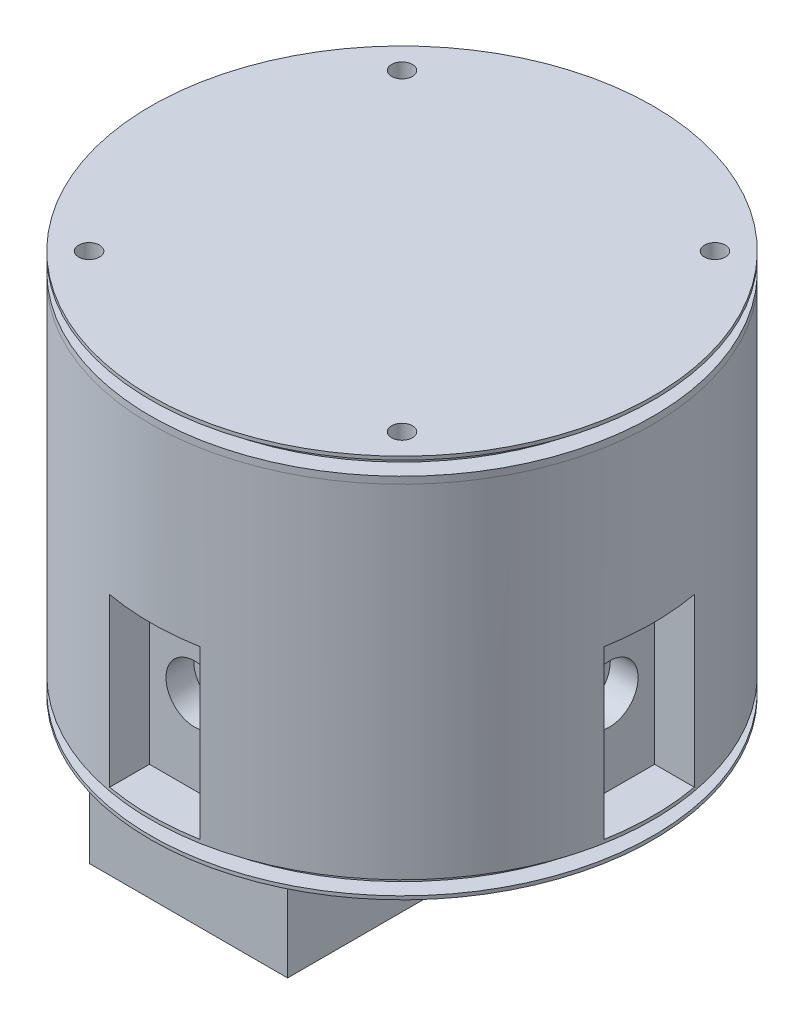
from build123d import *
from OCP.BRepFilletAPI import BRepFilletAPI_MakeFillet

# Parameters (mm, degrees)
EXTRUDE_START            = -2
SKETCH_1_R               = 72.25
EXTRUDE_8_DEPTH          = 99.5
SKETCH_5_W               = 10.5
SKETCH_5_H               = 22
SKETCH_5_W_2             = 22
SKETCH_5_H_2             = 10.5
CUT_EXTRUDE_1_DEPTH      = 48
SKETCH_40_R              = 8.25
CUT_EXTRUDE_2_DEPTH      = 8
PATTERN_CIRCULAR_1_COUNT = 4
SHELL_START              = -49.642711667
SHELL_6_OUTLINE_W        = 30
SHELL_6_OUTLINE_H        = 50
SHELL_6_DEPTH            = 99.285423334
SHELL_START_2            = -57.642711667
SHELL_6_2_OUTLINE_W      = 30
SHELL_6_2_OUTLINE_H      = 50
SHELL_6_2_OUTLINE_R      = 10.25
SHELL_6_2_DEPTH          = 115.285423334
SHELL_6_3_OUTLINE_W      = 50
SHELL_6_3_OUTLINE_H      = 30
SHELL_6_3_DEPTH          = 99.285423334
SHELL_6_4_OUTLINE_W      = 50
SHELL_6_4_OUTLINE_H      = 30
SHELL_6_4_OUTLINE_R      = 10.25
SHELL_6_4_DEPTH          = 115.285423334
SHELL_6_5_DEPTH          = 97.5
SHELL_START_3            = 50
SHELL_6_6_DEPTH          = 47.5
CUT_EXTRUDE_5_DEPTH      = 48
SKETCH_37_W              = 68
SKETCH_37_H              = 1.5
EXTRUDE_9_DEPTH          = 34
EXTRUDE_9_2_DEPTH        = 34
EXTRUDE_9_3_DEPTH        = 34
EXTRUDE_9_4_DEPTH        = 34
EXTRUDE_9_5_DEPTH        = 34
EXTRUDE_10_DEPTH         = 65
EXTRUDE_11_DEPTH         = 55
EXTRUDE_START_2          = -6
SKETCH_1_26_R            = 72.25
EXTRUDE_13_DEPTH         = 6
SKETCH_47_W              = 57
SKETCH_47_H              = 106
EXTRUDE_12_DEPTH         = 34
SKETCH_50_R              = 6
CUT_EXTRUDE_6_DEPTH      = 6
EXTRUDE_START_3          = 91.5
SKETCH_1_36_R            = 72.25
SKETCH_1_36_R_2          = 71
SKETCH_1_36_R_3          = 68
SKETCH_1_36_R_4          = 67
EXTRUDE_19_DEPTH         = 6
CUT_EXTRUDE_START        = 97.5
SKETCH_1_37_R            = 71
SKETCH_1_37_R_2          = 68
CUT_EXTRUDE_11_DEPTH     = 2
EXTRUDE_START_4          = -97.5
EXTRUDE_20_DEPTH         = 6
SKETCH_62_W              = 5
SKETCH_62_H              = 4
SKETCH_63_R              = 1.5
CUT_EXTRUDE_12_DEPTH     = 6
EXTRUDE_START_5          = 97.5
SKETCH_1_39_R            = 72.25
EXTRUDE_22_DEPTH         = 7
SKETCH_64_R              = 3
CUT_EXTRUDE_13_DEPTH     = 6
CUT_EXTRUDE_START_2      = 6
SKETCH_63_2_R            = 1.5
CUT_EXTRUDE_14_DEPTH     = 6
SKETCH_65_R              = 1.5
CUT_EXTRUDE_15_DEPTH     = 6
SKETCH_66_W              = 5
SKETCH_66_H              = 4
SKETCH_1_41_R            = 68
SKETCH_1_41_R_2          = 67
EXTRUDE_24_DEPTH         = 6
SKETCH_61_R              = 1.5
CUT_EXTRUDE_16_DEPTH     = 6
PATTERN_CIRCULAR_2_COUNT = 4
EXTRUDE_27_OUTLINE_W     = 85
EXTRUDE_27_OUTLINE_H     = 80
EXTRUDE_27_OUTLINE_R     = 2
EXTRUDE_27_DEPTH         = 25
SKETCH_71_W              = 85
SKETCH_71_H              = 80
EXTRUDE_28_DEPTH         = 1.8
EXTRUDE_START_6          = 25
EXTRUDE_29_DEPTH         = 1
EXTRUDE_30_OUTLINE_W     = 85
EXTRUDE_30_OUTLINE_H     = 80
EXTRUDE_30_OUTLINE_R     = 2
EXTRUDE_30_DEPTH         = 1.5
FILLET_2_R1              = 3
FILLET_2_R2              = 2
FILLET_3_R               = 3
SKETCH_72_R              = 4
CUT_EXTRUDE_17_DEPTH     = 7


with BuildPart() as part:
    # 草圖1 → 填料-伸長8 (new body)
    with BuildSketch(Plane(origin=(0, 0, 0), x_dir=(1, 0, 0), z_dir=(0, 1, 0)).offset(EXTRUDE_START)):
        with Locations(Location((0, 0, 0), (0, 0, 270))):
            Circle(SKETCH_1_R)
    extrude(amount=EXTRUDE_8_DEPTH)

    # 草圖5 → 除料-伸長1 (cut)
    with BuildSketch(Plane(origin=(0, 0, 0), x_dir=(1, 0, 0), z_dir=(0, 1, 0))):
        with Locations((64.892711667, 0)):
            Rectangle(SKETCH_5_W, SKETCH_5_H)
        with BuildLine():
            ThreePointArc((72.25, 0), (71.954602966, 6.526684613), (71.070827348, 13))
            Line((71.070827348, 13), (59.642711667, 13))
            Line((59.642711667, 13), (59.642711667, 11))
            Line((59.642711667, 11), (70.142711667, 11))
            Line((70.142711667, 11), (70.142711667, -11))
            Line((70.142711667, -11), (59.642711667, -11))
            Line((59.642711667, -11), (59.642711667, -13))
            Line((59.642711667, -13), (71.070827348, -13))
            ThreePointArc((71.070827348, -13), (71.954602966, -6.526684613), (72.25, 0))
        make_face()
        with Locations((0, 64.892711667)):
            Rectangle(SKETCH_5_W_2, SKETCH_5_H_2)
        with BuildLine():
            ThreePointArc((13, 71.070827348), (0, 72.25), (-13, 71.070827348))
            Line((-13, 71.070827348), (-13, 59.642711667))
            Line((-13, 59.642711667), (-11, 59.642711667))
            Line((-11, 59.642711667), (-11, 70.142711667))
            Line((-11, 70.142711667), (11, 70.142711667))
            Line((11, 70.142711667), (11, 59.642711667))
            Line((11, 59.642711667), (13, 59.642711667))
            Line((13, 59.642711667), (13, 71.070827348))
        make_face()
        with Locations((-64.892711667, 0)):
            Rectangle(SKETCH_5_W, SKETCH_5_H)
        with BuildLine():
            Line((-70.142711667, -11), (-70.142711667, 11))
            Line((-70.142711667, 11), (-59.642711667, 11))
            Line((-59.642711667, 11), (-59.642711667, 13))
            Line((-59.642711667, 13), (-71.070827348, 13))
            ThreePointArc((-71.070827348, 13), (-72.25, 0), (-71.070827348, -13))
            Line((-71.070827348, -13), (-59.642711667, -13))
            Line((-59.642711667, -13), (-59.642711667, -11))
            Line((-59.642711667, -11), (-70.142711667, -11))
        make_face()
        with Locations((0, -64.892711667)):
            Rectangle(SKETCH_5_W_2, SKETCH_5_H_2)
        with BuildLine():
            Line((-13, -59.642711667), (-13, -71.070827348))
            ThreePointArc((-13, -71.070827348), (0, -72.25), (13, -71.070827348))
            Line((13, -71.070827348), (13, -59.642711667))
            Line((13, -59.642711667), (11, -59.642711667))
            Line((11, -59.642711667), (11, -70.142711667))
            Line((11, -70.142711667), (-11, -70.142711667))
            Line((-11, -70.142711667), (-11, -59.642711667))
            Line((-11, -59.642711667), (-13, -59.642711667))
        make_face()
    extrude(amount=CUT_EXTRUDE_1_DEPTH, mode=Mode.SUBTRACT)

    # 草圖40 → 除料-伸長2 (cut)
    with BuildSketch(Plane(origin=(0, 0, -59.642711667), x_dir=(-1, 0, 0), z_dir=(0, 0, -1))):
        with Locations((0, 24)):
            Circle(SKETCH_40_R)
    cut_extrude_2 = extrude(amount=-CUT_EXTRUDE_2_DEPTH, mode=Mode.SUBTRACT)

    # 環狀複製排列1: 除料-伸長2 ×4 about axis
    pattern_circular_1_axis = Axis((0, 0, 0), (0, 1, 0))
    for i in range(1, PATTERN_CIRCULAR_1_COUNT):
        add(cut_extrude_2.rotate(pattern_circular_1_axis, i * 360 / PATTERN_CIRCULAR_1_COUNT), mode=Mode.SUBTRACT)

    # 薄殼6: read off the stored shape, not the designer's step
    # 薄殼6 outline → 薄殼6 (cut)
    with BuildSketch(Plane.XY.offset(SHELL_START)):
        with Locations((0, 25)):
            Rectangle(SHELL_6_OUTLINE_W, SHELL_6_OUTLINE_H)
    extrude(amount=SHELL_6_DEPTH, mode=Mode.SUBTRACT)

    # Shell 6 2 outline → Shell 6 2 (cut)
    with BuildSketch(Plane.XY.offset(SHELL_START_2)):
        with Locations((0, 25)):
            Rectangle(SHELL_6_2_OUTLINE_W, SHELL_6_2_OUTLINE_H)
        with Locations((0, 24)):
            Circle(SHELL_6_2_OUTLINE_R, mode=Mode.SUBTRACT)
    extrude(amount=SHELL_6_2_DEPTH, mode=Mode.SUBTRACT)

    # Shell 6 3 outline → Shell 6 3 (cut)
    with BuildSketch(Plane.YZ.offset(SHELL_START)):
        with Locations((25, 0)):
            Rectangle(SHELL_6_3_OUTLINE_W, SHELL_6_3_OUTLINE_H)
    extrude(amount=SHELL_6_3_DEPTH, mode=Mode.SUBTRACT)

    # Shell 6 4 outline → Shell 6 4 (cut)
    with BuildSketch(Plane.YZ.offset(SHELL_START_2)):
        with Locations((25, 0)):
            Rectangle(SHELL_6_4_OUTLINE_W, SHELL_6_4_OUTLINE_H)
        with Locations((24, 0)):
            Circle(SHELL_6_4_OUTLINE_R, mode=Mode.SUBTRACT)
    extrude(amount=SHELL_6_4_DEPTH, mode=Mode.SUBTRACT)

    # Shell 6 5 outline → Shell 6 5 (cut)
    with BuildSketch(Plane(origin=(0, 0, 0), x_dir=(1, 0, 0), z_dir=(0, 1, 0))):
        with BuildLine():
            Line((15, 15), (68.62989509, 15))
            ThreePointArc((68.62989509, 15), (49.674251378, 49.674251378), (15, 68.62989509))
            Line((15, 68.62989509), (15, 15))
        make_face()
        with BuildLine():
            ThreePointArc((15, -68.62989509), (49.674251378, -49.674251378), (68.62989509, -15))
            Line((68.62989509, -15), (15, -15))
            Line((15, -15), (15, -68.62989509))
        make_face()
        with BuildLine():
            Line((-15, 15), (-15, 68.62989509))
            ThreePointArc((-15, 68.62989509), (-49.674251378, 49.674251378), (-68.62989509, 15))
            Line((-68.62989509, 15), (-15, 15))
        make_face()
        with BuildLine():
            ThreePointArc((-68.62989509, -15), (-49.674251378, -49.674251378), (-15, -68.62989509))
            Line((-15, -68.62989509), (-15, -15))
            Line((-15, -15), (-68.62989509, -15))
        make_face()
    extrude(amount=SHELL_6_5_DEPTH, mode=Mode.SUBTRACT)

    # Shell 6 6 outline → Shell 6 6 (cut)
    with BuildSketch(Plane(origin=(0, 0, 0), x_dir=(1, 0, 0), z_dir=(0, 1, 0)).offset(SHELL_START_3)):
        with BuildLine():
            ThreePointArc((68.62989509, -15), (70.25, 0), (68.62989509, 15))
            Line((68.62989509, 15), (15, 15))
            Line((15, 15), (15, 68.62989509))
            ThreePointArc((15, 68.62989509), (0, 70.25), (-15, 68.62989509))
            Line((-15, 68.62989509), (-15, 15))
            Line((-15, 15), (-68.62989509, 15))
            ThreePointArc((-68.62989509, 15), (-70.25, 0), (-68.62989509, -15))
            Line((-68.62989509, -15), (-15, -15))
            Line((-15, -15), (-15, -68.62989509))
            ThreePointArc((-15, -68.62989509), (0, -70.25), (15, -68.62989509))
            Line((15, -68.62989509), (15, -15))
            Line((15, -15), (68.62989509, -15))
        make_face()
    extrude(amount=SHELL_6_6_DEPTH, mode=Mode.SUBTRACT)

    # 草圖43 → 除料-伸長5 (cut)
    with BuildSketch(Plane(origin=(0, 0, 0), x_dir=(1, 0, 0), z_dir=(0, 1, 0))):
        Polygon((15.617248129, 51.642711667), (-24.146545114, 51.642711667), (-51.642711667, 15.617248129), (-51.642711667, -24.146545114), (-15.617248129, -51.642711667), (24.146545114, -51.642711667), (51.642711667, -15.617248129), (51.642711667, 24.146545114), align=None)
    extrude(amount=CUT_EXTRUDE_5_DEPTH, mode=Mode.SUBTRACT)

    # 草圖1<26> → 填料-伸長13 (add)
    with BuildSketch(Plane(origin=(0, 0, 0), x_dir=(1, 0, 0), z_dir=(0, 1, 0)).offset(EXTRUDE_START_2)):
        with Locations(Location((0, 0, 0), (0, 0, 270))):
            Circle(SKETCH_1_26_R)
    extrude(amount=EXTRUDE_13_DEPTH)

    # 草圖50 → 除料-伸長6 (cut)
    with BuildSketch(Plane(origin=(0, 0, 0), x_dir=(1, 0, 0), z_dir=(0, 1, 0))):
        with Locations(Location((18.322761596, 49.972985564, 0), (0, 0, 270))):
            Circle(SKETCH_50_R)
        with Locations(Location((-49.972985564, -18.322761596, 0), (0, 0, 270))):
            Circle(SKETCH_50_R)
    extrude(amount=-CUT_EXTRUDE_6_DEPTH, mode=Mode.SUBTRACT)

    # 草圖1<36> → 填料-伸長19 (add)
    # profile 1 of 3: a face of its own
    with BuildSketch(Plane(origin=(0, 0, 0), x_dir=(1, 0, 0), z_dir=(0, 1, 0)).offset(EXTRUDE_START_3)):
        with Locations(Location((0, 0, 0), (0, 0, 270))):
            Circle(SKETCH_1_36_R)
        Circle(SKETCH_1_36_R_2, mode=Mode.SUBTRACT)
    # profile 2 of 3: a face of its own
    with BuildSketch(Plane(origin=(0, 0, 0), x_dir=(1, 0, 0), z_dir=(0, 1, 0)).offset(EXTRUDE_START_3)):
        Circle(SKETCH_1_36_R_2)
        Circle(SKETCH_1_36_R_3, mode=Mode.SUBTRACT)
    # profile 3 of 3: a face of its own
    with BuildSketch(Plane(origin=(0, 0, 0), x_dir=(1, 0, 0), z_dir=(0, 1, 0)).offset(EXTRUDE_START_3)):
        Circle(SKETCH_1_36_R_3)
        with Locations(Location((0, 0, 0), (0, 0, 270))):
            Circle(SKETCH_1_36_R_4, mode=Mode.SUBTRACT)
    extrude(amount=EXTRUDE_19_DEPTH)

    # 草圖1<37> → 除料-伸長11 (cut)
    with BuildSketch(Plane(origin=(0, 0, 0), x_dir=(1, 0, 0), z_dir=(0, 1, 0)).offset(CUT_EXTRUDE_START)):
        with Locations(Location((0, 0, 0), (0, 0, 270))):
            Circle(SKETCH_1_37_R)
        with Locations(Location((0, 0, 0), (0, 0, 270))):
            Circle(SKETCH_1_37_R_2, mode=Mode.SUBTRACT)
    extrude(amount=-CUT_EXTRUDE_11_DEPTH, mode=Mode.SUBTRACT)

    # 草圖57 → 填料-伸長20 (add)
    with BuildSketch(Plane.XZ.offset(6).offset(EXTRUDE_START_4)):
        with BuildLine():
            Line((-49.280774487, 45.39168719), (-45, 41.110912703))
            Line((-45, 41.110912703), (-41.110912703, 45))
            Line((-41.110912703, 45), (-45.39168719, 49.280774487))
            ThreePointArc((-45.39168719, 49.280774487), (-47.376154339, 47.376154339), (-49.280774487, 45.39168719))
        make_face()
        with BuildLine():
            Line((-45, -41.110912703), (-49.280774487, -45.39168719))
            ThreePointArc((-49.280774487, -45.39168719), (-47.376154339, -47.376154339), (-45.39168719, -49.280774487))
            Line((-45.39168719, -49.280774487), (-41.110912703, -45))
            Line((-41.110912703, -45), (-45, -41.110912703))
        make_face()
        with BuildLine():
            Line((41.110912703, -45), (45.39168719, -49.280774487))
            ThreePointArc((45.39168719, -49.280774487), (47.376154339, -47.376154339), (49.280774487, -45.39168719))
            Line((49.280774487, -45.39168719), (45, -41.110912703))
            Line((45, -41.110912703), (41.110912703, -45))
        make_face()
        with BuildLine():
            ThreePointArc((49.280774487, 45.39168719), (47.376154339, 47.376154339), (45.39168719, 49.280774487))
            Line((45.39168719, 49.280774487), (41.110912703, 45))
            Line((41.110912703, 45), (45, 41.110912703))
            Line((45, 41.110912703), (49.280774487, 45.39168719))
        make_face()
    extrude(amount=-EXTRUDE_20_DEPTH)

    # 草圖62 → 除料-旋轉2 (revolve, cut)
    with BuildSketch(Plane(origin=(0, 0, 0), x_dir=(-0.7071067811865476, 0, 0.7071067811865476), z_dir=(-0.7071067811865476, 0, -0.7071067811865476)), mode=Mode.PRIVATE) as cut_revolve_2_sk:
        with Locations((-69.75, -3)):
            Rectangle(SKETCH_62_W, SKETCH_62_H)
    revolve(cut_revolve_2_sk.sketch.rotate(Axis((0, 0, 0), (0, 1, 0)), 45), axis=Axis((0, 0, 0), (0, 1, 0)), mode=Mode.SUBTRACT)

    # 草圖63 → 除料-伸長12 (cut)
    with BuildSketch(Plane(origin=(0, 97.5, 0), x_dir=(1, 0, 0), z_dir=(0, 1, 0))):
        with Locations(Location((-45, 45, 0), (0, 0, 270))):
            Circle(SKETCH_63_R)
        with Locations(Location((45, 45, 0), (0, 0, 270))):
            Circle(SKETCH_63_R)
        with Locations(Location((45, -45, 0), (0, 0, 270))):
            Circle(SKETCH_63_R)
        with Locations(Location((-45, -45, 0), (0, 0, 270))):
            Circle(SKETCH_63_R)
    extrude(amount=-CUT_EXTRUDE_12_DEPTH, mode=Mode.SUBTRACT)

    # 草圖1<41> → 填料-伸長24 (add)
    with BuildSketch(Plane(origin=(0, 0, 0), x_dir=(1, 0, 0), z_dir=(0, 1, 0)).offset(EXTRUDE_START_3)):
        with Locations(Location((0, 0, 0), (0, 0, 270))):
            Circle(SKETCH_1_41_R)
        Circle(SKETCH_1_41_R_2, mode=Mode.SUBTRACT)
    extrude(amount=EXTRUDE_24_DEPTH)

    # 草圖61 → 除料-伸長16 (cut)
    with BuildSketch(Plane(origin=(0, 0, 0), x_dir=(1, 0, 0), z_dir=(0, 1, 0))):
        with Locations(Location((-42.426406871, 0, 0), (0, 0, 90))):
            Circle(SKETCH_61_R)
    cut_extrude_16 = extrude(amount=-CUT_EXTRUDE_16_DEPTH, mode=Mode.SUBTRACT)

    # 環狀複製排列2: 除料-伸長16 ×4 about axis
    pattern_circular_2_axis = Axis((0, 0, 0), (0, 1, 0))
    for i in range(1, PATTERN_CIRCULAR_2_COUNT):
        add(cut_extrude_16.rotate(pattern_circular_2_axis, i * 360 / PATTERN_CIRCULAR_2_COUNT), mode=Mode.SUBTRACT)


with BuildPart() as body_2:
    # 草圖37 → 填料-伸長9 (new, symmetric)
    with BuildSketch(Plane(origin=(0, 0, 0), x_dir=(-0.7071067811865476, 0, 0.7071067811865476), z_dir=(-0.7071067811865476, 0, -0.7071067811865476))):
        with Locations((0, 48.75)):
            Rectangle(SKETCH_37_W, SKETCH_37_H)
    extrude(amount=EXTRUDE_9_DEPTH, both=True)


with BuildPart() as body_3:
    # 草圖37 → Extrude 9 2 (new, symmetric)
    with BuildSketch(Plane(origin=(0, 0, 0), x_dir=(-0.7071067811865476, 0, 0.7071067811865476), z_dir=(-0.7071067811865476, 0, -0.7071067811865476))):
        Polygon((-34, 33), (-34, 31.5), (-31.5, 31.5), (34, 31.5), (34, 33), align=None)
    extrude(amount=EXTRUDE_9_2_DEPTH, both=True)


with BuildPart() as body_4:
    # 草圖37 → Extrude 9 3 (new, symmetric)
    with BuildSketch(Plane(origin=(0, 0, 0), x_dir=(-0.7071067811865476, 0, 0.7071067811865476), z_dir=(-0.7071067811865476, 0, -0.7071067811865476))):
        Polygon((-34, 16.5), (-34, 15), (34, 15), (34, 16.5), (-31.5, 16.5), align=None)
    extrude(amount=EXTRUDE_9_3_DEPTH, both=True)


with BuildPart() as body_5:
    # 草圖37 → Extrude 9 4 (new, symmetric)
    with BuildSketch(Plane(origin=(0, 0, 0), x_dir=(-0.7071067811865476, 0, 0.7071067811865476), z_dir=(-0.7071067811865476, 0, -0.7071067811865476))):
        with Locations((0, 65.25)):
            Rectangle(SKETCH_37_W, SKETCH_37_H)
    extrude(amount=EXTRUDE_9_4_DEPTH, both=True)


with BuildPart() as body_6:
    # 草圖37 → Extrude 9 5 (new, symmetric)
    with BuildSketch(Plane(origin=(0, 0, 0), x_dir=(-0.7071067811865476, 0, 0.7071067811865476), z_dir=(-0.7071067811865476, 0, -0.7071067811865476))):
        with Locations((0, 81.75)):
            Rectangle(SKETCH_37_W, SKETCH_37_H)
    extrude(amount=EXTRUDE_9_5_DEPTH, both=True)


with BuildPart() as body_7:
    # 草圖41 → 填料-伸長10 (new body)
    with BuildSketch(Plane(origin=(0, 0, 0), x_dir=(1, 0, 0), z_dir=(0, 1, 0))):
        Polygon((48.371425758, -10.597532563), (10.187659574, -48.781298747), (22.915581635, -61.509220808), (61.099347819, -23.325454624), align=None)
    extrude(amount=EXTRUDE_10_DEPTH)


with BuildPart() as body_8:
    # 草圖46 → 填料-伸長11 (new body)
    with BuildSketch(Plane(origin=(0, 0, 0), x_dir=(1, 0, 0), z_dir=(0, 1, 0))):
        Polygon((-21.653402574, -57.008741633), (-22.714062746, -58.069401805), (-58.069401805, -22.714062746), (-57.008741633, -21.653402574), align=None)
    extrude(amount=EXTRUDE_11_DEPTH)


with BuildPart() as body_9:
    # 草圖47 → 填料-伸長12 (new body)
    with BuildSketch(Plane(origin=(0, 0, 0), x_dir=(1, 0, 0), z_dir=(0, 1, 0)).offset(EXTRUDE_START_2)):
        with Locations((-8.402499724, 0)):
            Rectangle(SKETCH_47_W, SKETCH_47_H)
    extrude(amount=-EXTRUDE_12_DEPTH)


with BuildPart() as body_10:
    # 草圖1<39> → 填料-伸長22 (new body)
    with BuildSketch(Plane(origin=(0, 0, 0), x_dir=(1, 0, 0), z_dir=(0, 1, 0)).offset(EXTRUDE_START_5)):
        with Locations(Location((0, 0, 0), (0, 0, 270))):
            Circle(SKETCH_1_39_R)
    extrude(amount=EXTRUDE_22_DEPTH)

    # 草圖64 → 除料-伸長13 (cut)
    with BuildSketch(Plane(origin=(0, 104.5, 0), x_dir=(1, 0, 0), z_dir=(0, 1, 0))):
        with Locations(Location((-45, 45, 0), (0, 0, 270))):
            Circle(SKETCH_64_R)
        with Locations(Location((45, 45, 0), (0, 0, 270))):
            Circle(SKETCH_64_R)
        with Locations(Location((45, -45, 0), (0, 0, 270))):
            Circle(SKETCH_64_R)
        with Locations(Location((-45, -45, 0), (0, 0, 270))):
            Circle(SKETCH_64_R)
    extrude(amount=-CUT_EXTRUDE_13_DEPTH, mode=Mode.SUBTRACT)

    # 草圖63<2> → 除料-伸長14 (cut)
    with BuildSketch(Plane(origin=(0, 97.5, 0), x_dir=(1, 0, 0), z_dir=(0, 1, 0)).offset(CUT_EXTRUDE_START_2)):
        with Locations(Location((-45, 45, 0), (0, 0, 270))):
            Circle(SKETCH_63_2_R)
        with Locations(Location((45, 45, 0), (0, 0, 270))):
            Circle(SKETCH_63_2_R)
        with Locations(Location((45, -45, 0), (0, 0, 270))):
            Circle(SKETCH_63_2_R)
        with Locations(Location((-45, -45, 0), (0, 0, 270))):
            Circle(SKETCH_63_2_R)
    extrude(amount=-CUT_EXTRUDE_14_DEPTH, mode=Mode.SUBTRACT)

    # 草圖65 → 除料-伸長15 (cut)
    with BuildSketch(Plane.XZ.offset(-97.5)):
        with Locations(Location((-42.426406871, 0, 0), (0, 0, 270))):
            Circle(SKETCH_65_R)
        with Locations(Location((0, 42.426406871, 0), (0, 0, 270))):
            Circle(SKETCH_65_R)
        with Locations(Location((42.426406871, 0, 0), (0, 0, 270))):
            Circle(SKETCH_65_R)
        with Locations(Location((0, -42.426406871, 0), (0, 0, 270))):
            Circle(SKETCH_65_R)
    extrude(amount=-CUT_EXTRUDE_15_DEPTH, mode=Mode.SUBTRACT)

    # 草圖66 → 除料-旋轉3 (revolve, cut)
    with BuildSketch(Plane(origin=(0, 0, 0), x_dir=(-0.7071067811865476, 0, 0.7071067811865476), z_dir=(-0.7071067811865476, 0, -0.7071067811865476)), mode=Mode.PRIVATE) as cut_revolve_3_sk:
        with Locations((-69.75, 101.5)):
            Rectangle(SKETCH_66_W, SKETCH_66_H)
    revolve(cut_revolve_3_sk.sketch.rotate(Axis((0, 0, 0), (0, 1, 0)), 45), axis=Axis((0, 0, 0), (0, 1, 0)), mode=Mode.SUBTRACT)


with BuildPart() as body_11:
    # 填料-伸長27: read off the stored shape, not the designer's step
    # 填料-伸長27 outline → 填料-伸長27 (new body)
    with BuildSketch(Plane(origin=(0, 0, 0), x_dir=(1, 0, 0), z_dir=(0, 1, 0))):
        Rectangle(EXTRUDE_27_OUTLINE_W, EXTRUDE_27_OUTLINE_H)
        with Locations((-39, -36.5)):
            Circle(EXTRUDE_27_OUTLINE_R, mode=Mode.SUBTRACT)
        with Locations((39, -36.5)):
            Circle(EXTRUDE_27_OUTLINE_R, mode=Mode.SUBTRACT)
        with Locations((-39, 36.5)):
            Circle(EXTRUDE_27_OUTLINE_R, mode=Mode.SUBTRACT)
        with BuildLine():
            Line((35.5, -36), (35.5, -38))
            Line((35.5, -38), (-35.5, -38))
            Line((-35.5, -38), (-35.5, -36))
            ThreePointArc((-35.5, -36), (-36.378679656, -33.878679656), (-38.5, -33))
            Line((-38.5, -33), (-40.5, -33))
            Line((-40.5, -33), (-40.5, 33))
            Line((-40.5, 33), (-38.5, 33))
            ThreePointArc((-38.5, 33), (-36.378679656, 33.878679656), (-35.5, 36))
            Line((-35.5, 36), (-35.5, 38))
            Line((-35.5, 38), (35.5, 38))
            Line((35.5, 38), (35.5, 36))
            ThreePointArc((35.5, 36), (36.378679656, 33.878679656), (38.5, 33))
            Line((38.5, 33), (40.5, 33))
            Line((40.5, 33), (40.5, -33))
            Line((40.5, -33), (38.5, -33))
            ThreePointArc((38.5, -33), (36.378679656, -33.878679656), (35.5, -36))
        make_face(mode=Mode.SUBTRACT)
        with Locations((39, 36.5)):
            Circle(EXTRUDE_27_OUTLINE_R, mode=Mode.SUBTRACT)
    extrude(amount=EXTRUDE_27_DEPTH)

    # 草圖71 → 填料-伸長28 (add)
    with BuildSketch(Plane(origin=(0, 0, 0), x_dir=(1, 0, 0), z_dir=(0, 1, 0))):
        Rectangle(SKETCH_71_W, SKETCH_71_H)
    extrude(amount=-EXTRUDE_28_DEPTH)

    # 圓角2: one fillet with a radius per group of edges: ONE call of the kernel's fillet builder (fillet() takes one radius for all edges)
    fillet_2_edges_1 = [body_11.edges().sort_by_distance(p)[0] for p in [
        (-42.5, 11.6, -40),
        (42.5, 11.6, -40),
        (-42.5, 11.6, 40),
        (42.5, 11.6, 40),
    ]]
    fillet_2_edges_2 = [body_11.edges().sort_by_distance(p)[0] for p in [
        (42.5, -1.8, 0),
        (0, -1.8, 40),
        (0, -1.8, -40),
        (-42.5, -1.8, 0),
    ]]
    fillet_2 = BRepFilletAPI_MakeFillet(body_11.part.solid().wrapped)
    for e in fillet_2_edges_1:
        fillet_2.Add(FILLET_2_R1, e.wrapped)
    for e in fillet_2_edges_2:
        fillet_2.Add(FILLET_2_R2, e.wrapped)
    add(Compound.cast(fillet_2.Shape()), mode=Mode.REPLACE)

    # 草圖72 → 除料-伸長17 (cut)
    with BuildSketch(Plane.XY.offset(40)):
        with Locations((-31.789343958, 8.073086361)):
            Circle(SKETCH_72_R)
    extrude(amount=-CUT_EXTRUDE_17_DEPTH, mode=Mode.SUBTRACT)


with BuildPart() as body_12:
    # 草圖69<7> → 填料-伸長29 (new body)
    with BuildSketch(Plane(origin=(0, 0, 0), x_dir=(1, 0, 0), z_dir=(0, 1, 0)).offset(EXTRUDE_START_6)):
        with BuildLine():
            Line((35.5, 38), (-35.5, 38))
            Line((-35.5, 38), (-35.5, 36))
            ThreePointArc((-35.5, 36), (-36.378679656, 33.878679656), (-38.5, 33))
            Line((-38.5, 33), (-40.5, 33))
            Line((-40.5, 33), (-40.5, -33))
            Line((-40.5, -33), (-38.5, -33))
            ThreePointArc((-38.5, -33), (-36.378679656, -33.878679656), (-35.5, -36))
            Line((-35.5, -36), (-35.5, -38))
            Line((-35.5, -38), (35.5, -38))
            Line((35.5, -38), (35.5, -36))
            ThreePointArc((35.5, -36), (36.378679656, -33.878679656), (38.5, -33))
            Line((38.5, -33), (40.5, -33))
            Line((40.5, -33), (40.5, 33))
            Line((40.5, 33), (38.5, 33))
            ThreePointArc((38.5, 33), (36.378679656, 33.878679656), (35.5, 36))
            Line((35.5, 36), (35.5, 38))
        make_face()
    extrude(amount=-EXTRUDE_29_DEPTH)

    # 填料-伸長30: read off the stored shape, not the designer's step
    # 填料-伸長30 outline → 填料-伸長30 (add)
    with BuildSketch(Plane(origin=(0, 0, 0), x_dir=(1, 0, 0), z_dir=(0, 1, 0)).offset(EXTRUDE_START_6)):
        Rectangle(EXTRUDE_30_OUTLINE_W, EXTRUDE_30_OUTLINE_H)
        with Locations((-39, -36.5)):
            Circle(EXTRUDE_30_OUTLINE_R, mode=Mode.SUBTRACT)
        with Locations((39, -36.5)):
            Circle(EXTRUDE_30_OUTLINE_R, mode=Mode.SUBTRACT)
        with Locations((-39, 36.5)):
            Circle(EXTRUDE_30_OUTLINE_R, mode=Mode.SUBTRACT)
        with Locations((39, 36.5)):
            Circle(EXTRUDE_30_OUTLINE_R, mode=Mode.SUBTRACT)
    extrude(amount=EXTRUDE_30_DEPTH)

    # 圓角3
    fillet_3_edges = [body_12.edges().sort_by_distance(p)[0] for p in [
        (-42.5, 25.75, 40),
        (42.5, 25.75, 40),
        (42.5, 25.75, -40),
        (-42.5, 25.75, -40),
    ]]
    fillet(fillet_3_edges, radius=FILLET_3_R)


solid = Compound([part.part, body_2.part, body_3.part, body_4.part, body_5.part, body_6.part, body_7.part, body_8.part, body_9.part, body_10.part, body_11.part, body_12.part])
